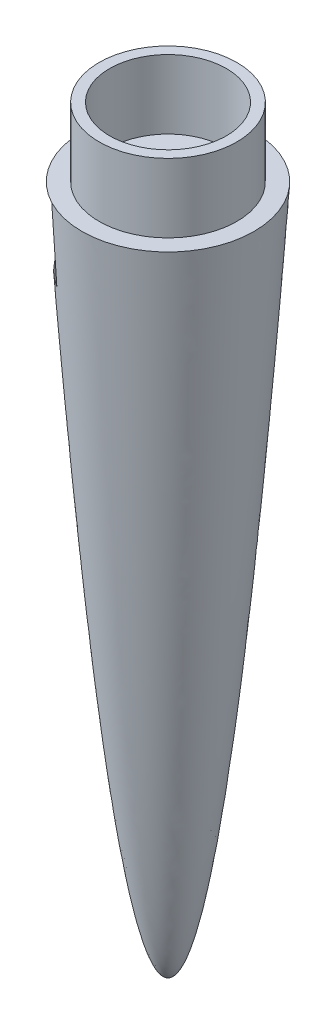
from build123d import *


with BuildPart() as part:
    # Sketch4 → Revolve2 (revolve)
    with BuildSketch(Plane(origin=(0, 0, 0), x_dir=(0, 0, -1), z_dir=(1, 0, 0))):
        with BuildLine():
            Line((-7.937596759, 63.461082229), (-6.35, 63.461082229))
            Line((-6.35, 63.461082229), (-6.35, 69.811082229))
            Line((-6.35, 69.811082229), (-5.382282251, 69.811082229))
            Line((-5.382282251, 69.811082229), (-5.382282251, 63.461082229))
            Line((-5.382282251, 63.461082229), (0, 63.461082229))
            Line((0, 63.461082229), (0, 0))
            add(Edge.make_bspline(
                [(0, 0), (-0.036893981, -9.2317e-05), (-0.085651838, 0.004861374), (-0.147159585, 0.020115913), (-0.223876295, 0.052141137), (-0.283528261, 0.084371889), (-0.351903292, 0.130742518), (-0.432243175, 0.198094816), (-0.528081054, 0.295705157), (-0.649619604, 0.447259921), (-0.810122072, 0.693060954), (-1.036803006, 1.129160985), (-1.377699029, 1.971061951), (-1.893557356, 3.685826363), (-2.521273256, 6.548991804), (-3.180530623, 10.479147581), (-3.827902927, 15.203009106), (-4.423842424, 20.284640267), (-4.951956386, 25.327326964), (-5.437985183, 30.446846382), (-5.880391538, 35.452984216), (-6.306550285, 40.652205343), (-6.688767185, 45.540289731), (-7.084715915, 50.945241556), (-7.408349338, 55.499810375), (-7.70851668, 59.969363745), (-7.862332166, 62.303567999), (-7.937596759, 63.461082229)],
                knots=[0, 0, 0, 0, 0, 0.002070005, 0.002771214, 0.003558119, 0.004690252, 0.005895102, 0.007432898, 0.009472261, 0.012412914, 0.016849151, 0.024013797, 0.03717915, 0.063736652, 0.117806225, 0.189835435, 0.261864658, 0.333893879, 0.405923101, 0.477952323, 0.549981545, 0.622010767, 0.694039989, 0.766069211, 0.838098433, 0.910127655, 0.910127655, 0.910127655, 0.910127655, 0.910127655], degree=4))
        make_face()
    revolve(axis=Axis((0, 2.616e-06, 0), (0, 1, 0)))


solid = part.part
